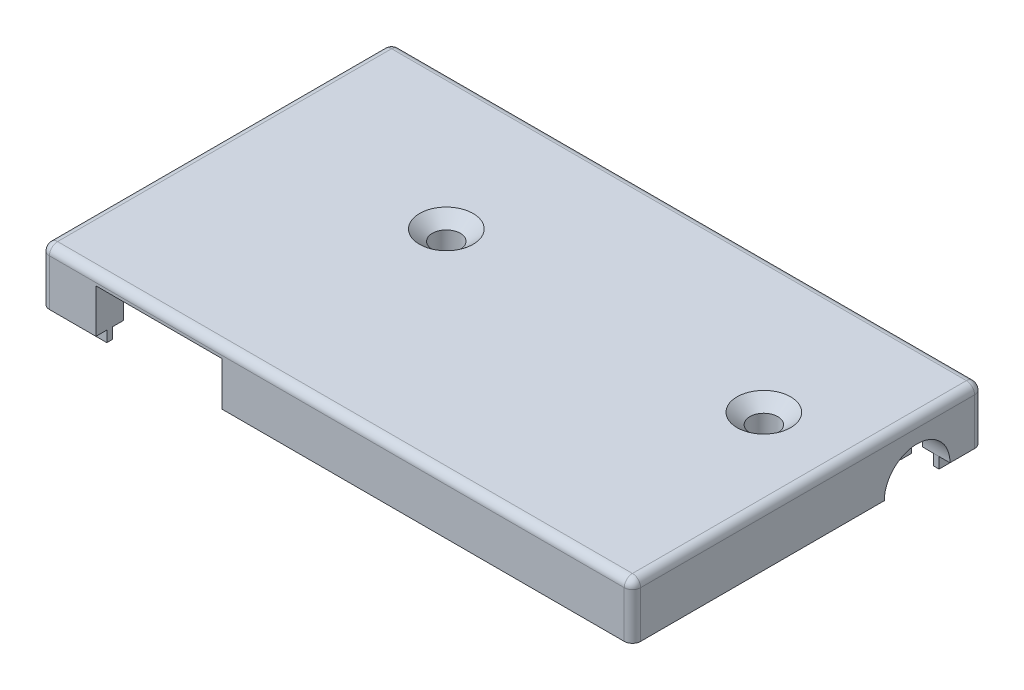
from build123d import *

# Parameters (mm, degrees)
BASIC_BOX_OUTLINE_W                                = 108
BASIC_BOX_OUTLINE_H                                = 64
BASIC_BOX_OUTLINE_W_2                              = 98
BASIC_BOX_OUTLINE_H_2                              = 54
SIDE_WALLS_DEPTH                                   = 10
BOTTOM_START                                       = -2
BOTTOM_WALL_OUTLINE_W                              = 98
BOTTOM_WALL_OUTLINE_H                              = 54
BOTTOM_WALL_DEPTH                                  = 2
INNER_WALLS_TO_HOLD_DEVICES_W                      = 2
INNER_WALLS_TO_HOLD_DEVICES_H                      = 16
INSIDE_WALLS_DEPTH                                 = 10
SCREW_HOLES_R                                      = 5
SCREWS_DEPTH                                       = 10
ALIGNMENT_W                                        = 104
ALIGNMENT_H                                        = 60
ALIGNMENT_W_2                                      = 102
ALIGNMENT_H_2                                      = 58
ALIGNMENT_BUMP_DEPTH                               = 2
LEFT_START                                         = -5
LEFT_HOLE_DEPTH                                    = 5
RIGHT_HOLE_DEPTH                                   = 5
SKETCH6_W                                          = 23
SKETCH6_H                                          = 10
CUT_EXTRUDE2_DEPTH                                 = 10
CSK_FOR_10_FLAT_HEAD_MACHINE_SCREW_100_D           = 5.1054
CSK_FOR_10_FLAT_HEAD_MACHINE_SCREW_100_CSINK_D     = 9.779
CSK_FOR_10_FLAT_HEAD_MACHINE_SCREW_100_CSINK_ANGLE = 100
FILLET1_R                                          = 1.5
FILLET2_R                                          = 1.5
FILLET3_R                                          = 1


# Read off the part's stored shape, not the designer's step: bottom wall
with BuildPart() as part:
    # basic box outline → side walls (new body)
    with BuildSketch(Plane(origin=(0, 0, 0), x_dir=(1, 0, 0), z_dir=(0, 1, 0))):
        with Locations((0, 32)):
            Rectangle(BASIC_BOX_OUTLINE_W, BASIC_BOX_OUTLINE_H)
        with Locations((0, 32)):
            Rectangle(BASIC_BOX_OUTLINE_W_2, BASIC_BOX_OUTLINE_H_2, mode=Mode.SUBTRACT)
    extrude(amount=-SIDE_WALLS_DEPTH)

    # bottom wall outline → bottom wall (add)
    with BuildSketch(Plane(origin=(0, 0, 0), x_dir=(1, 0, 0), z_dir=(0, 1, 0)).offset(BOTTOM_START)):
        with Locations((0, 32)):
            Rectangle(BOTTOM_WALL_OUTLINE_W, BOTTOM_WALL_OUTLINE_H)
    extrude(amount=BOTTOM_WALL_DEPTH)

    # inner walls to hold devices → inside walls (add)
    with BuildSketch(Plane(origin=(0, 0, 0), x_dir=(1, 0, 0), z_dir=(0, 1, 0))):
        Polygon((-47, 59), (-49, 59), (-49, 55.5), (-33, 55.5), (-33, 58), (-24, 58), (-24, 54), (-14, 54), (-14, 55), (1, 55), (1, 59), (-1, 59), (-1, 57), (-16, 57), (-16, 56), (-22, 56), (-22, 59), (-35, 59), (-35, 57.5), (-47, 57.5), align=None)
        Polygon((27, 59), (25, 59), (25, 55), (40, 55), (40, 54), (49, 54), (49, 56), (42, 56), (42, 57), (27, 57), align=None)
        Polygon((49, 50), (40, 50), (40, 49), (25, 49), (25, 41), (16, 41), (16, 39), (27, 39), (27, 47), (42, 47), (42, 48), (49, 48), align=None)
        Polygon((-14, 50), (-24, 50), (-24, 46), (-33, 46), (-33, 48.5), (-35, 48.5), (-35, 21), (-33, 21), (-33, 44), (-22, 44), (-22, 48), (-16, 48), (-16, 47), (-1, 47), (-1, 39), (5, 39), (5, 41), (1, 41), (1, 49), (-14, 49), align=None)
        with Locations((-12, 13)):
            Rectangle(INNER_WALLS_TO_HOLD_DEVICES_W, INNER_WALLS_TO_HOLD_DEVICES_H)
    extrude(amount=-INSIDE_WALLS_DEPTH)

    # screw holes → screws (add)
    with BuildSketch(Plane(origin=(0, 0, 0), x_dir=(1, 0, 0), z_dir=(0, 1, 0))):
        with Locations(Location((-19, 39, 0), (0, 0, 270))):
            Circle(SCREW_HOLES_R)
        with Locations(Location((39, 39, 0), (0, 0, 270))):
            Circle(SCREW_HOLES_R)
    extrude(amount=-SCREWS_DEPTH)

    # alignment → alignment bump (add)
    with BuildSketch(Plane(origin=(0, -10, 0), x_dir=(-1, 0, 0), z_dir=(0, -1, 0))):
        with Locations((0, 32)):
            Rectangle(ALIGNMENT_W, ALIGNMENT_H)
        with Locations((0, 32)):
            Rectangle(ALIGNMENT_W_2, ALIGNMENT_H_2, mode=Mode.SUBTRACT)
    extrude(amount=ALIGNMENT_BUMP_DEPTH)

    # hole 1 → left hole (cut)
    with BuildSketch(Plane(origin=(54, 0, 0), x_dir=(0, 0, -1), z_dir=(1, 0, 0)).offset(LEFT_START)):
        with BuildLine():
            Line((46, -10), (46, -12))
            Line((46, -12), (58, -12))
            Line((58, -12), (58, -10))
            ThreePointArc((58, -10), (52, -4), (46, -10))
        make_face()
    extrude(amount=LEFT_HOLE_DEPTH, mode=Mode.SUBTRACT)

    # hole 2 → right hole (cut)
    with BuildSketch(Plane.ZY.offset(54)):
        with BuildLine():
            Line((-58, -10), (-58, -12))
            Line((-58, -12), (-46, -12))
            Line((-46, -12), (-46, -10))
            ThreePointArc((-46, -10), (-52, -4), (-58, -10))
        make_face()
    extrude(amount=-RIGHT_HOLE_DEPTH, mode=Mode.SUBTRACT)

    # Sketch6 → Cut-Extrude2 (cut)
    with BuildSketch(Plane.XY):
        with Locations((-32.5, -7)):
            Rectangle(SKETCH6_W, SKETCH6_H)
    extrude(amount=-CUT_EXTRUDE2_DEPTH, mode=Mode.SUBTRACT)

    # CSK for #10 Flat Head Machine Screw (100)1 (through all)
    with Locations(Plane(origin=(0, 0, 0), x_dir=(1, 0, 0), z_dir=(0, 1, 0))):
        with Locations((-19, 39), (39, 39)):
            CounterSinkHole(CSK_FOR_10_FLAT_HEAD_MACHINE_SCREW_100_D / 2, CSK_FOR_10_FLAT_HEAD_MACHINE_SCREW_100_CSINK_D / 2, counter_sink_angle=CSK_FOR_10_FLAT_HEAD_MACHINE_SCREW_100_CSINK_ANGLE)

    # Fillet1
    fillet1_edges = [part.edges().sort_by_distance(p)[0] for p in [
        (-52, -11, -2),
        (-52, -11, -62),
        (52, -11, -62),
        (52, -11, -2),
        (-51, -11, -61),
        (51, -11, -61),
        (51, -11, -3),
        (-51, -11, -3),
        (-54, -5, -64),
        (54, -5, -64),
        (54, -5, 0),
        (-54, -5, 0),
    ]]
    fillet(fillet1_edges, radius=FILLET1_R)

    # Fillet2
    fillet2_edges = [part.edges().sort_by_distance(p)[0] for p in [
        (0, 0, -64),
        (-54, 0, -32),
        (0, 0, 0),
        (54, 0, -32),
        (-53.560660172, 0, -0.439339828),
        (53.560660172, 0, -0.439339828),
        (53.560660172, 0, -63.560660172),
        (-53.560660172, 0, -63.560660172),
    ]]
    fillet(fillet2_edges, radius=FILLET2_R)

    # Fillet3
    # the kernel refuses this fillet: 1 mm, written as the material it adds along each edge
    with BuildSketch(Plane(origin=(-19, -2, -39), x_dir=(0, 0, 1), z_dir=(-1, 0, 0))) as fillet3_piece_1:
        with BuildLine():
            CenterArc((5 + FILLET3_R, -FILLET3_R), FILLET3_R, 90, 90)
            Line((5, -FILLET3_R), (5, 0))
            Line((5, 0), (5 + FILLET3_R, 0))
        make_face()
    revolve(axis=Axis((-19, -2, -39), (0, 1, 0)))
    with BuildSketch(Plane(origin=(39, -2, -39), x_dir=(0, 0, 1), z_dir=(-1, 0, 0))) as fillet3_piece_2:
        with BuildLine():
            CenterArc((5 + FILLET3_R, -FILLET3_R), FILLET3_R, 90, 90)
            Line((5, -FILLET3_R), (5, 0))
            Line((5, 0), (5 + FILLET3_R, 0))
        make_face()
    revolve(axis=Axis((39, -2, -39), (0, 1, 0)))


solid = part.part
